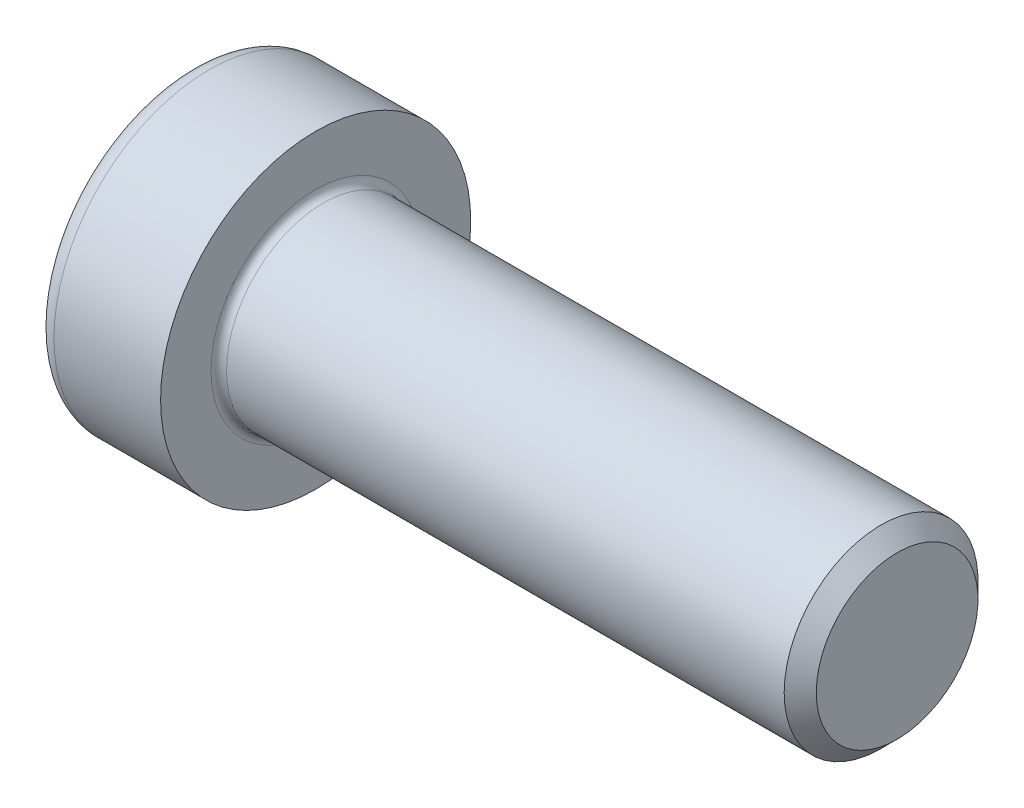
from build123d import *

# Parameters (mm, degrees)
FILLET1_R   = 0.4
FILLET2_R   = 1
HEX_2_DEPTH = 3.65


with BuildPart() as part:
    # BodySke → Base-Revolve (revolve)
    with BuildSketch(Plane.XY):
        Polygon((0, 0), (0, 8), (6.5, 8), (6.5, 5), (35.672, 5), (36.5, 4.172), (36.5, 0), align=None)
    revolve(axis=Axis((-31.75, 0, 0), (1, 0, 0)))

    # Fillet1
    fillet1_edges = [part.edges().sort_by_distance(p)[0] for p in [
        (6.5, -5, 0),
    ]]
    fillet(fillet1_edges, radius=FILLET1_R)

    # Fillet2
    fillet2_edges = [part.edges().sort_by_distance(p)[0] for p in [
        (0, -8, 0),
    ]]
    fillet(fillet2_edges, radius=FILLET2_R)

    # HexSke → Hex 2 (cut)
    with BuildSketch(Plane(origin=(0, 0, 0), x_dir=(0, 0.500000000000001, 0.866025403784438), z_dir=(-1, 0, 0))):
        Polygon((2.359919225, 4.0875), (-2.359919225, 4.0875), (-4.719838451, 0), (-2.359919225, -4.0875), (2.359919225, -4.0875), (4.719838451, 0), align=None)
    extrude(amount=-HEX_2_DEPTH, mode=Mode.SUBTRACT)

    # PilotSke → Hex-PreBroach (revolve, cut)
    with BuildSketch(Plane.XY):
        Polygon((0, 4.0875), (3.65, 4.0875), (4.544892917, 2.5375), (7.86, 2.5375), (9.325026308, 0), (0, 0), align=None)
    revolve(axis=Axis((0, 0, 0), (1, 0, 0)), mode=Mode.SUBTRACT)


solid = part.part
